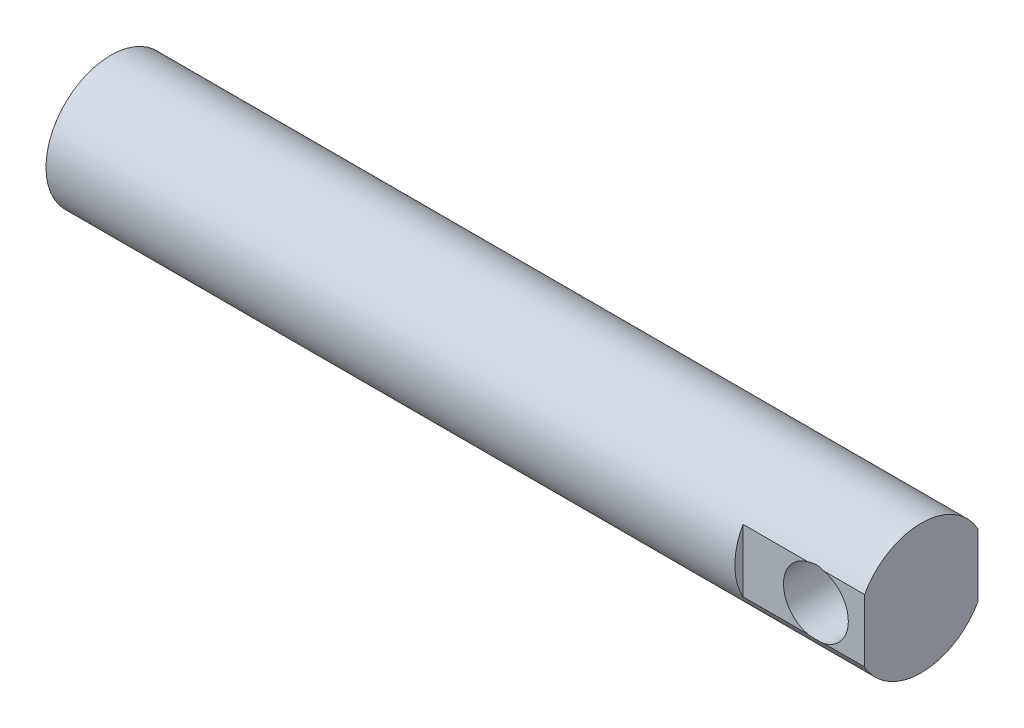
from build123d import *

# Parameters (mm, degrees)
SKETCH2_R           = 25.4
BOSS_EXTRUDE1_DEPTH = 158.75
CUT_EXTRUDE1_DEPTH  = 47.625
SKETCH4_R           = 12.7
CUT_EXTRUDE2_DEPTH  = 168.674873267


with BuildPart() as part:
    # Sketch2 → Boss-Extrude1 (new, symmetric)
    with BuildSketch(Plane(origin=(0, 0, 0), x_dir=(0, 0, -1), z_dir=(1, 0, 0))):
        Circle(SKETCH2_R)
    extrude(amount=BOSS_EXTRUDE1_DEPTH, both=True)

    # Sketch3 → Cut-Extrude1 (cut)
    with BuildSketch(Plane(origin=(158.75, 0, 0), x_dir=(0, 0, -1), z_dir=(1, 0, 0))):
        with BuildLine():
            Line((-22.225, 12.296722124), (-22.225, -12.296722124))
            ThreePointArc((-22.225, -12.296722124), (-25.4, 0), (-22.225, 12.296722124))
        make_face()
        with BuildLine():
            Line((22.225, 12.296722124), (22.225, -12.296722124))
            ThreePointArc((22.225, -12.296722124), (25.4, 0), (22.225, 12.296722124))
        make_face()
    extrude(amount=-CUT_EXTRUDE1_DEPTH, mode=Mode.SUBTRACT)

    # Sketch4 → Cut-Extrude2 (cut, through all)
    with BuildSketch(Plane.XY.offset(22.225)):
        with Locations((139.7, 0)):
            Circle(SKETCH4_R)
    extrude(amount=-CUT_EXTRUDE2_DEPTH, mode=Mode.SUBTRACT)


solid = part.part
